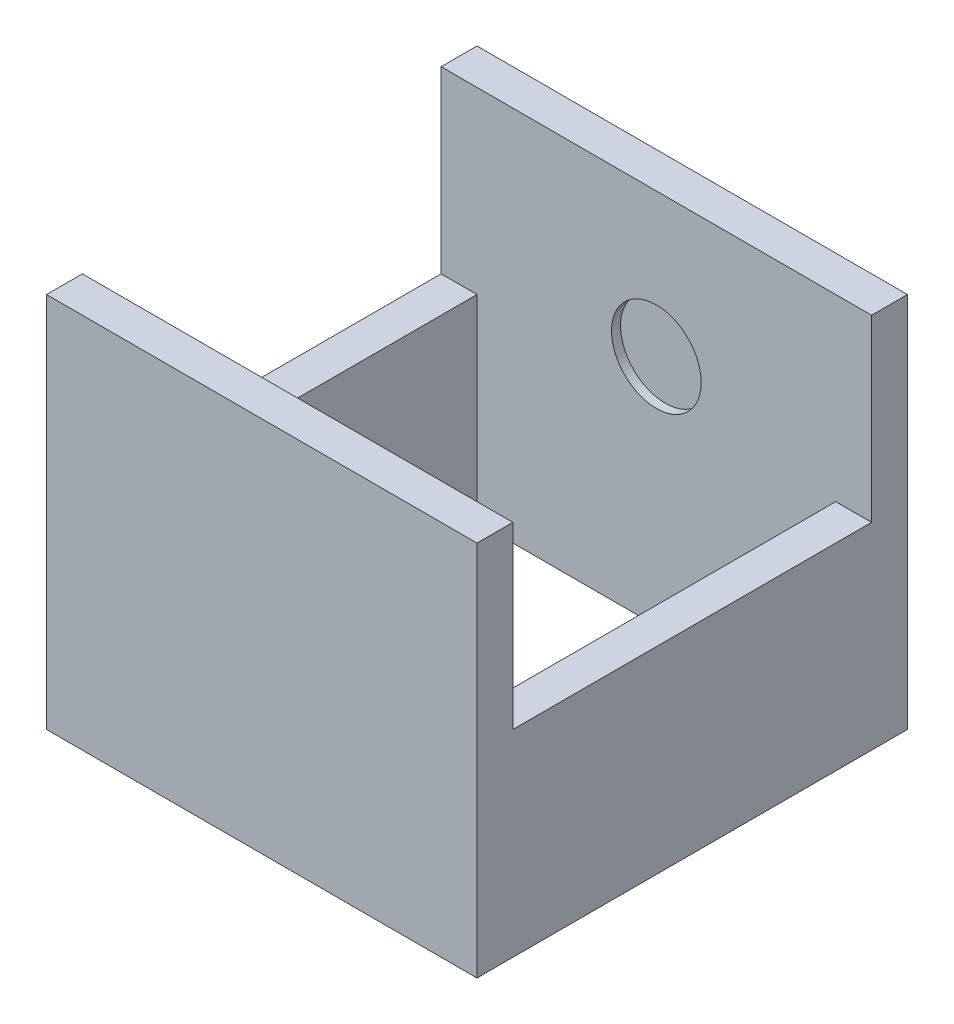
from build123d import *

# Parameters (mm, degrees)
SKETCH7_W               = 240
SKETCH7_H               = 240
BOSS_EXTRUDE3_DEPTH     = 210
SKETCH9_R               = 25
CUT_EXTRUDE3_DEPTH      = 105
SKETCH10_W              = 200
SKETCH10_H              = 200
CUT_EXTRUDE4_DEPTH      = 210
CUT_EXTRUDE6_DEPTH      = 327.955654485
CUT_EXTRUDE6_DEPTH_BACK = 327.955654485
SKETCH12_W              = 200
SKETCH12_H              = 100


with BuildPart() as part:
    # Sketch7 → Boss-Extrude3 (new body)
    with BuildSketch(Plane(origin=(0, 0, 0), x_dir=(1, 0, 0), z_dir=(0, 1, 0))):
        Rectangle(SKETCH7_W, SKETCH7_H)
    extrude(amount=BOSS_EXTRUDE3_DEPTH)

    # Sketch9 → Cut-Extrude3 (cut, symmetric)
    with BuildSketch(Plane.XY):
        with Locations((0, 130)):
            Circle(SKETCH9_R)
    extrude(amount=CUT_EXTRUDE3_DEPTH, both=True, mode=Mode.SUBTRACT)

    # Sketch10 → Cut-Extrude4 (cut)
    with BuildSketch(Plane.XZ):
        Rectangle(SKETCH10_W, SKETCH10_H)
    extrude(amount=-CUT_EXTRUDE4_DEPTH, mode=Mode.SUBTRACT)

    # Sketch12 → Cut-Extrude6 (cut, two sides: drawn at the far end of the back side and taken through both)
    with BuildSketch(Plane(origin=(-100, 0, 0), x_dir=(0, 0, -1), z_dir=(1, 0, 0)).offset(-CUT_EXTRUDE6_DEPTH_BACK)):
        with Locations((0, 160)):
            Rectangle(SKETCH12_W, SKETCH12_H)
    extrude(amount=CUT_EXTRUDE6_DEPTH + CUT_EXTRUDE6_DEPTH_BACK, mode=Mode.SUBTRACT)


solid = part.part
